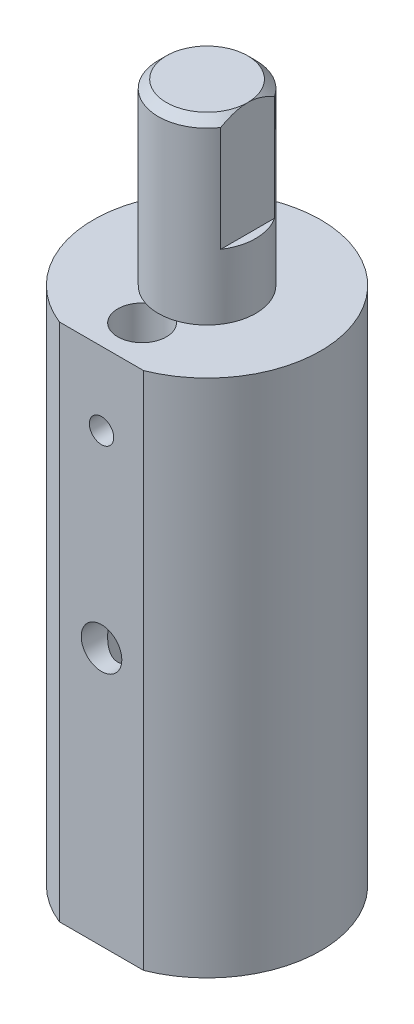
from build123d import *

# Parameters (mm, degrees)
SKETCH1_R           = 2
SKETCH1_R_2         = 6
SKETCH1_R_3         = 3
BOSS_EXTRUDE1_DEPTH = 14
SKETCH2_R           = 6
SKETCH2_R_2         = 3
BOSS_EXTRUDE2_DEPTH = 38
SKETCH3_R           = 3
BOSS_EXTRUDE3_DEPTH = 12
SKETCH4_R           = 6
BOSS_EXTRUDE4_DEPTH = 22
CUT_EXTRUDE1_START  = -14
CUT_EXTRUDE1_DEPTH  = 14
CHAMFER1_SIZE       = 1
SKETCH6_R           = 2.5
CUT_EXTRUDE2_DEPTH  = 5
SKETCH7_R           = 1.5
CUT_EXTRUDE3_DEPTH  = 15


with BuildPart() as part:
    # Sketch1 → Boss-Extrude1 (new body)
    with BuildSketch(Plane(origin=(0, 0, 0), x_dir=(1, 0, 0), z_dir=(0, 1, 0))):
        with BuildLine():
            Line((5.196152423, -13), (-5.196152423, -13))
            ThreePointArc((-5.196152423, -13), (0, 14), (5.196152423, -13))
        make_face()
        with Locations(Location((-9, 0, 0), (0, 0, 270))):
            Circle(SKETCH1_R, mode=Mode.SUBTRACT)
        with Locations(Location((9, 0, 0), (0, 0, 270))):
            Circle(SKETCH1_R, mode=Mode.SUBTRACT)
        with Locations(Location((0, 5, 0), (0, 0, 270))):
            Circle(SKETCH1_R_2, mode=Mode.SUBTRACT)
        with Locations(Location((0, -8, 0), (0, 0, 270))):
            Circle(SKETCH1_R_3, mode=Mode.SUBTRACT)
    extrude(amount=BOSS_EXTRUDE1_DEPTH)

    # Sketch2 → Boss-Extrude2 (add)
    with BuildSketch(Plane(origin=(0, 14, 0), x_dir=(1, 0, 0), z_dir=(0, 1, 0))):
        with BuildLine():
            Line((-5.196152423, -13), (5.196152423, -13))
            ThreePointArc((5.196152423, -13), (0, 14), (-5.196152423, -13))
        make_face()
        with Locations(Location((0, 5, 0), (0, 0, 270))):
            Circle(SKETCH2_R, mode=Mode.SUBTRACT)
        with Locations(Location((0, -8, 0), (0, 0, 270))):
            Circle(SKETCH2_R_2, mode=Mode.SUBTRACT)
    extrude(amount=BOSS_EXTRUDE2_DEPTH)

    # Sketch3 → Boss-Extrude3 (add)
    with BuildSketch(Plane(origin=(0, 52, 0), x_dir=(1, 0, 0), z_dir=(0, 1, 0))):
        with BuildLine():
            Line((-5.196152423, -13), (5.196152423, -13))
            ThreePointArc((5.196152423, -13), (0, 14), (-5.196152423, -13))
        make_face()
        with Locations(Location((0, -8, 0), (0, 0, 270))):
            Circle(SKETCH3_R, mode=Mode.SUBTRACT)
    extrude(amount=BOSS_EXTRUDE3_DEPTH)

    # Sketch4 → Boss-Extrude4 (add)
    with BuildSketch(Plane(origin=(0, 64, 0), x_dir=(1, 0, 0), z_dir=(0, 1, 0))):
        with Locations(Location((0, 0, 0), (0, 0, 251.426650281))):
            Circle(SKETCH4_R)
    extrude(amount=BOSS_EXTRUDE4_DEPTH)

    # Sketch5 → Cut-Extrude1 (cut)
    with BuildSketch(Plane(origin=(0, 86, 0), x_dir=(1, 0, 0), z_dir=(0, 1, 0)).offset(CUT_EXTRUDE1_START)):
        with BuildLine():
            Line((5, 3.31662479), (5, -3.31662479))
            ThreePointArc((5, -3.31662479), (6, 0), (5, 3.31662479))
        make_face()
    extrude(amount=CUT_EXTRUDE1_DEPTH, mode=Mode.SUBTRACT)

    # Chamfer1
    chamfer1_edges = [part.edges().sort_by_distance(p)[0] for p in [
        (-4.759608727, 86, -3.653234836),
    ]]
    chamfer(chamfer1_edges, length=CHAMFER1_SIZE - 0.0001)  # a hair under: the kernel refuses the full size

    # Sketch6 → Cut-Extrude2 (cut)
    with BuildSketch(Plane.XY.offset(13)):
        with Locations((0, 31.800606355)):
            Circle(SKETCH6_R)
    extrude(amount=-CUT_EXTRUDE2_DEPTH, mode=Mode.SUBTRACT)

    # Sketch7 → Cut-Extrude3 (cut)
    with BuildSketch(Plane.XY.offset(13)):
        with Locations((0, 55)):
            Circle(SKETCH7_R)
    extrude(amount=-CUT_EXTRUDE3_DEPTH, mode=Mode.SUBTRACT)


solid = part.part
